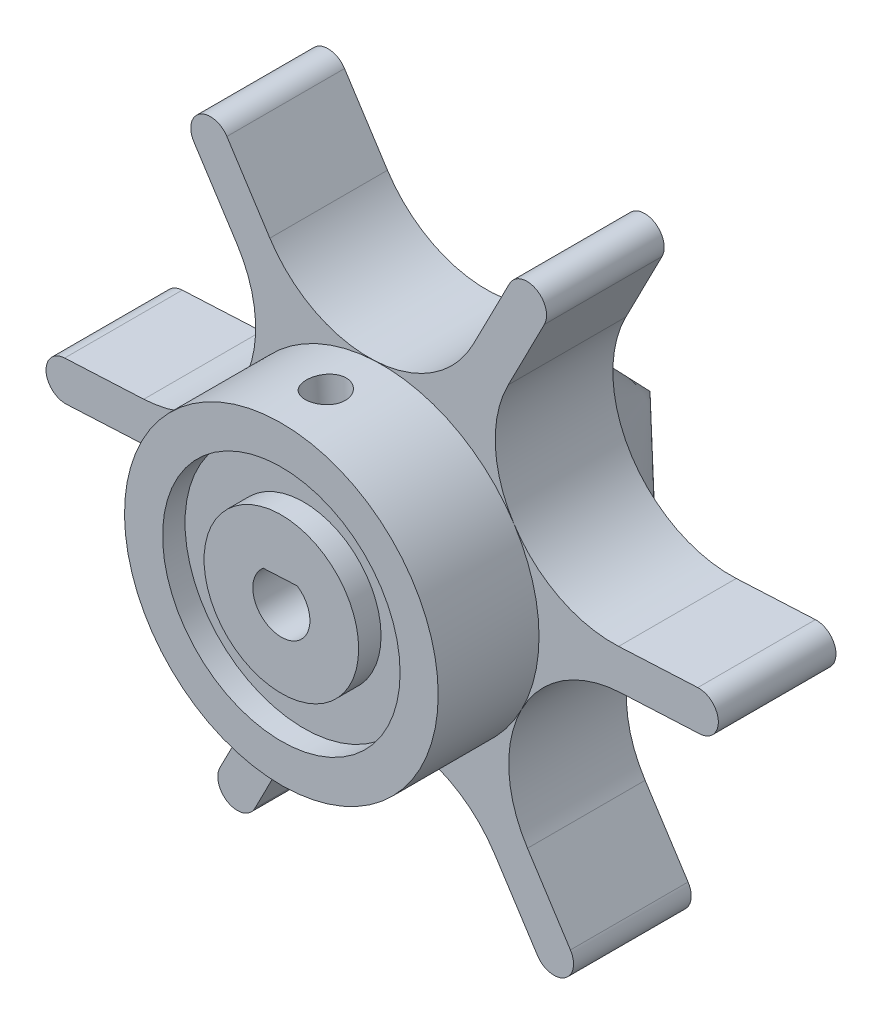
from build123d import *

# Parameters (mm, degrees)
BOSS_EXTRUDE1_DEPTH     = 21
SKETCH4_R               = 28
BOSS_EXTRUDE2_DEPTH     = 18
SKETCH6_R               = 21.2
SKETCH6_R_2             = 13.8
CUT_EXTRUDE1_DEPTH      = 4
CUT_EXTRUDE2_DEPTH      = 20
CUT_EXTRUDE3_DEPTH      = 93.206949894
CUT_EXTRUDE3_DEPTH_BACK = 93.206949894
SKETCH7_R               = 1.75
SKETCH8_R               = 3.5
CUT_EXTRUDE4_DEPTH      = 5.5


with BuildPart() as part:
    # Sketch1 → Boss-Extrude1 (new body)
    with BuildSketch(Plane.XY):
        with BuildLine():
            Line((-20.0569058, 37.559559765), (-27.723010785, 49.447123338))
            ThreePointArc((-27.723010785, 49.447123338), (-32.561288987, 50.491663446), (-33.605829095, 45.653385243))
            Line((-33.605829095, 45.653385243), (-25.93972411, 33.765821671))
            ThreePointArc((-25.93972411, 33.765821671), (-24.90753088, 12.791204222), (-42.555985811, 1.409989939))
            Line((-42.555985811, 1.409989939), (-56.683970347, 0.71473006))
            ThreePointArc((-56.683970347, 0.71473006), (-60.007707717, -2.95307172), (-56.339905937, -6.27680909))
            Line((-56.339905937, -6.27680909), (-42.211921401, -5.581549211))
            ThreePointArc((-42.211921401, -5.581549211), (-23.531273241, -15.174952377), (-22.499080012, -36.149569826))
            Line((-22.499080012, -36.149569826), (-28.960959562, -48.732393278))
            ThreePointArc((-28.960959562, -48.732393278), (-27.44641873, -53.444735165), (-22.734076842, -51.930194333))
            Line((-22.734076842, -51.930194333), (-16.272197292, -39.347370882))
            ThreePointArc((-16.272197292, -39.347370882), (1.376257639, -27.966156599), (20.0569058, -37.559559765))
            Line((20.0569058, -37.559559765), (27.723010785, -49.447123338))
            ThreePointArc((27.723010785, -49.447123338), (32.561288987, -50.491663446), (33.605829095, -45.653385243))
            Line((33.605829095, -45.653385243), (25.93972411, -33.765821671))
            ThreePointArc((25.93972411, -33.765821671), (24.90753088, -12.791204222), (42.555985811, -1.409989939))
            Line((42.555985811, -1.409989939), (56.683970347, -0.71473006))
            ThreePointArc((56.683970347, -0.71473006), (60.007707717, 2.95307172), (56.339905937, 6.27680909))
            Line((56.339905937, 6.27680909), (42.211921401, 5.581549211))
            ThreePointArc((42.211921401, 5.581549211), (23.531273241, 15.174952377), (22.499080012, 36.149569826))
            Line((22.499080012, 36.149569826), (28.960959562, 48.732393278))
            ThreePointArc((28.960959562, 48.732393278), (27.44641873, 53.444735165), (22.734076842, 51.930194333))
            Line((22.734076842, 51.930194333), (16.272197292, 39.347370882))
            ThreePointArc((16.272197292, 39.347370882), (-1.376257639, 27.966156599), (-20.0569058, 37.559559765))
        make_face()
    extrude(amount=BOSS_EXTRUDE1_DEPTH)

    # Sketch3 → Revolve1 (revolve)
    with BuildSketch(Plane(origin=(0, 0, 0), x_dir=(-0.9987913071010414, -0.04915205854685543, 0), z_dir=(0.04915205854685543, -0.9987913071010414, 0))):
        Polygon((0, 0), (-28, 0), (0, 26.813467396), align=None)
    revolve(axis=Axis((0, 0, -26.813467396), (0, 0, 1)))

    # Sketch4 → Boss-Extrude2 (add)
    with BuildSketch(Plane.XY.offset(21)):
        Circle(SKETCH4_R)
    extrude(amount=BOSS_EXTRUDE2_DEPTH)

    # Sketch6 → Cut-Extrude1 (cut)
    with BuildSketch(Plane.XY.offset(39)):
        Circle(SKETCH6_R)
        Circle(SKETCH6_R_2, mode=Mode.SUBTRACT)
    extrude(amount=-CUT_EXTRUDE1_DEPTH, mode=Mode.SUBTRACT)

    # Sketch5 → Cut-Extrude2 (cut)
    with BuildSketch(Plane.XY.offset(39)):
        with BuildLine():
            Line((2.82796059, 4.244129934), (-3.231007471, 3.945958784))
            ThreePointArc((-3.231007471, 3.945958784), (-2.183101223, -4.609128882), (5.1, 0))
            ThreePointArc((5.1, 0), (4.496253941, 2.407010697), (2.82796059, 4.244129934))
        make_face()
    extrude(amount=-CUT_EXTRUDE2_DEPTH, mode=Mode.SUBTRACT)

    # Sketch7 → Cut-Extrude3 (cut, two sides: drawn at the far end of the back side and taken through both)
    with BuildSketch(Plane(origin=(-0.20152344, 4.095044359, 0), x_dir=(0.9987913071010414, 0.049152058546853936, 0), z_dir=(0.049152058546853936, -0.9987913071010414, 0)).offset(-CUT_EXTRUDE3_DEPTH_BACK)):
        with Locations((0, 29.7)):
            Circle(SKETCH7_R)
    extrude(amount=CUT_EXTRUDE3_DEPTH + CUT_EXTRUDE3_DEPTH_BACK, mode=Mode.SUBTRACT)

    # Sketch8 → Cut-Extrude4 (cut)
    with BuildSketch(Plane(origin=(-1.376257639, 27.966156599, 0), x_dir=(0.9987913071010414, 0.049152058546855434, 0), z_dir=(-0.049152058546855434, 0.9987913071010414, 0))):
        with Locations((0, -29.7)):
            Circle(SKETCH8_R)
    extrude(amount=-CUT_EXTRUDE4_DEPTH, mode=Mode.SUBTRACT)


solid = part.part
